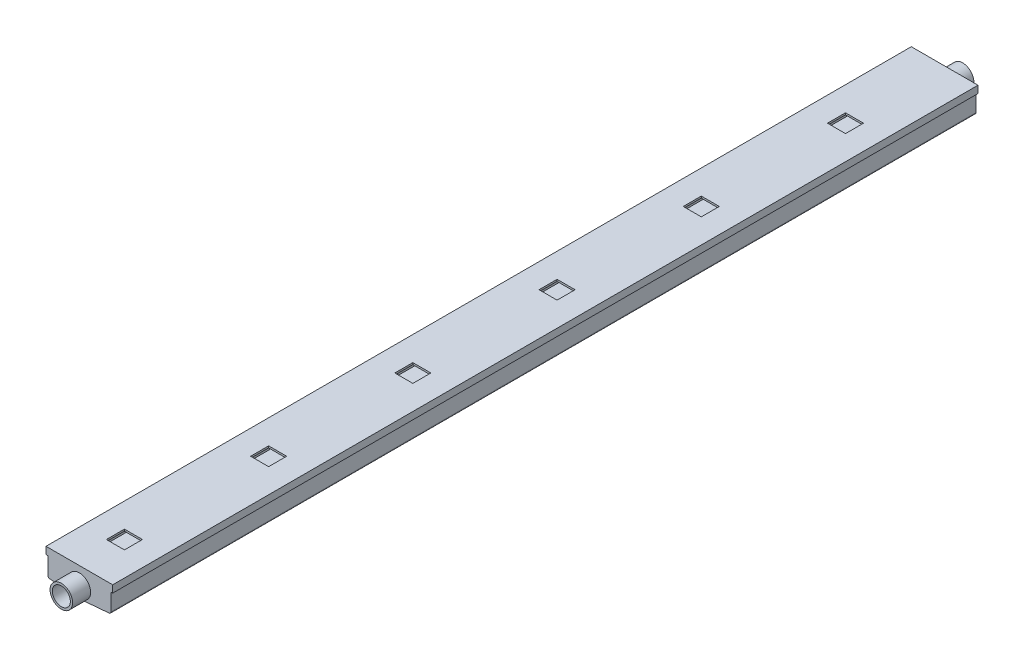
from build123d import *

# Parameters (mm, degrees)
BOSS_EXTRUDE1_DEPTH    = 1219.2
SKETCH2_W              = 1219.2
SKETCH2_H              = 7.62
BOSS_EXTRUDE2_DEPTH    = 2.54
SKETCH3_W              = 1219.2
SKETCH3_H              = 7.62
BOSS_EXTRUDE3_DEPTH    = 2.54
SKETCH4_R              = 15.875
SKETCH4_R_2            = 12.7
BOSS_EXTRUDE4_DEPTH    = 25.4
BOSS_EXTRUDE5_START    = 25.4
SKETCH6_R              = 15.875
SKETCH6_R_2            = 12.7
BOSS_EXTRUDE5_DEPTH    = 25.4
SHELL2_START           = 2.54
SHELL2_DEPTH           = 1214.12
SKETCH9_W              = 93.98
SKETCH9_H              = 1219.2
BOSS_EXTRUDE7_DEPTH    = 2.54
FILLET1_R              = 2.54
CUT_EXTRUDE3_START     = -2.54
CUT_EXTRUDE3_OUTLINE_R = 12.7
CUT_EXTRUDE3_DEPTH     = 2.54
SKETCH11_R             = 12.7
CUT_EXTRUDE4_DEPTH     = 2.54
CUT_EXTRUDE5_REACH     = 1250.616
SKETCH12_W             = 25.4
SKETCH12_H             = 25.4
LPATTERN1_COUNT        = 6
LPATTERN1_PITCH        = 203.2


# Read off the part's stored shape, not the designer's step: Shell2, Cut-Extrude3
with BuildPart() as part:
    # Sketch1 → Boss-Extrude1 (new body)
    with BuildSketch(Plane.XY):
        Polygon((0, 0), (0, 34.29), (88.9, 34.29), (88.9, 0), (44.45, -3.81), align=None)
    extrude(amount=BOSS_EXTRUDE1_DEPTH)

    # Sketch2 → Boss-Extrude2 (add)
    with BuildSketch(Plane(origin=(88.9, 0, 0), x_dir=(0, 0, -1), z_dir=(1, 0, 0))):
        with Locations((-609.6, 30.48)):
            Rectangle(SKETCH2_W, SKETCH2_H)
    extrude(amount=BOSS_EXTRUDE2_DEPTH)

    # Sketch3 → Boss-Extrude3 (add)
    with BuildSketch(Plane.ZY):
        with Locations((609.6, 30.48)):
            Rectangle(SKETCH3_W, SKETCH3_H)
    extrude(amount=BOSS_EXTRUDE3_DEPTH)

    # Sketch4 → Boss-Extrude4 (add)
    with BuildSketch(Plane(origin=(0, 0, 0), x_dir=(-1, 0, 0), z_dir=(0, 0, -1))):
        with Locations(Location((-44.45, 12.065, 0), (0, 0, 260.201815092))):
            Circle(SKETCH4_R)
        with Locations((-44.45, 12.065)):
            Circle(SKETCH4_R_2, mode=Mode.SUBTRACT)
    extrude(amount=BOSS_EXTRUDE4_DEPTH)

    # Sketch6 → Boss-Extrude5 (add)
    with BuildSketch(Plane.XY.offset(1219.2).offset(BOSS_EXTRUDE5_START)):
        with Locations(Location((44.45, 12.065, 0), (0, 0, 279.798184908))):
            Circle(SKETCH6_R)
        with Locations(Location((44.45, 12.065, 0), (0, 0, 180))):
            Circle(SKETCH6_R_2, mode=Mode.SUBTRACT)
    extrude(amount=-BOSS_EXTRUDE5_DEPTH)

    # Shell2 outline → Shell2 (cut)
    with BuildSketch(Plane.XY.offset(SHELL2_START)):
        Polygon((44.45, -1.260686463), (86.36, 2.331599251), (86.36, 29.21), (88.9, 29.21), (88.9, 34.29), (0, 34.29), (0, 29.21), (2.54, 29.21), (2.54, 2.331599251), align=None)
    extrude(amount=SHELL2_DEPTH, mode=Mode.SUBTRACT)

    # Sketch9 → Boss-Extrude7 (add)
    with BuildSketch(Plane(origin=(0, 34.29, 0), x_dir=(1, 0, 0), z_dir=(0, 1, 0))):
        with Locations((44.45, -609.6)):
            Rectangle(SKETCH9_W, SKETCH9_H)
    extrude(amount=BOSS_EXTRUDE7_DEPTH)

    # Fillet1
    fillet1_edges = [part.edges().sort_by_distance(p)[0] for p in [
        (0, 0, 609.6),
        (88.9, 0, 609.6),
    ]]
    fillet(fillet1_edges, radius=FILLET1_R)

    # Cut-Extrude3 outline → Cut-Extrude3 (cut)
    with BuildSketch(Plane(origin=(0, 0, 0), x_dir=(-1, 0, 0), z_dir=(0, 0, -1)).offset(CUT_EXTRUDE3_START)):
        with Locations((-44.45, 12.065)):
            Circle(CUT_EXTRUDE3_OUTLINE_R)
    extrude(amount=CUT_EXTRUDE3_DEPTH, mode=Mode.SUBTRACT)

    # Sketch11 → Cut-Extrude4 (cut)
    with BuildSketch(Plane.XY.offset(1219.2)):
        with Locations((44.45, 12.065)):
            Circle(SKETCH11_R)
    extrude(amount=-CUT_EXTRUDE4_DEPTH, mode=Mode.SUBTRACT)

    # Sketch12 → Cut-Extrude5 (cut, up to next)
    with BuildSketch(Plane(origin=(0, 36.83, 0), x_dir=(1, 0, 0), z_dir=(0, 1, 0)), mode=Mode.PRIVATE) as cut_extrude5_sk1:
        with Locations((44.45, -1155.7)):
            Rectangle(SKETCH12_W, SKETCH12_H)
    cut_extrude5_tool1 = extrude(cut_extrude5_sk1.sketch, amount=-CUT_EXTRUDE5_REACH, mode=Mode.PRIVATE) & part.part
    cut_extrude5 = cut_extrude5_tool1.solids().sort_by_distance((44.45, 36.83, 1155.7))[0]
    add(cut_extrude5, mode=Mode.SUBTRACT)

    # LPattern1: Cut-Extrude5 ×6
    with Locations(*[(0, 0, -i * LPATTERN1_PITCH) for i in range(1, LPATTERN1_COUNT)]):
        add(cut_extrude5, mode=Mode.SUBTRACT)


solid = part.part
